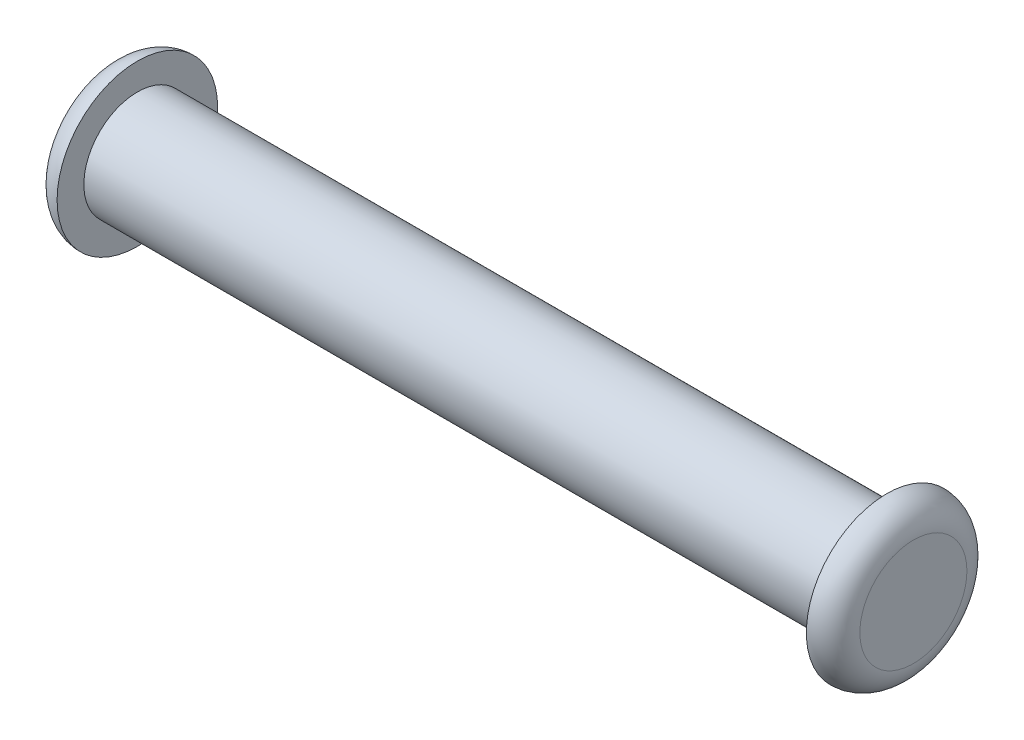
from build123d import *

# Parameters (mm, degrees)
SKETCH2_R            = 2
BOSS_EXTRUDE1_DEPTH  = 28
SKETCH3_R            = 3
BOSS_EXTRUDE2_DEPTH  = 1
FILLET1_R            = 1
FILLET1_OF_MIRROR1_R = 1


with BuildPart() as part:
    # Sketch2 → Boss-Extrude1 (new body)
    with BuildSketch(Plane(origin=(0, 0, 0), x_dir=(0, 0, -1), z_dir=(1, 0, 0))):
        Circle(SKETCH2_R)
    extrude(amount=BOSS_EXTRUDE1_DEPTH)

    # Sketch3 → Boss-Extrude2 (add)
    with BuildSketch(Plane(origin=(28, 0, 0), x_dir=(0, 0, -1), z_dir=(1, 0, 0))):
        Circle(SKETCH3_R)
    boss_extrude2 = extrude(amount=BOSS_EXTRUDE2_DEPTH)

    # Fillet1
    fillet1_edges = [part.edges().sort_by_distance(p)[0] for p in [
        (29, 0, 3),
    ]]
    fillet(fillet1_edges, radius=FILLET1_R - 0.0001)  # a hair under: the kernel refuses the full size

    # Mirror1: Boss-Extrude2 across plane
    add(boss_extrude2.mirror(Plane.ZY.offset(-14)))

    # Fillet1 of Mirror1
    fillet1_of_mirror1_edges = [part.edges().sort_by_distance(p)[0] for p in [
        (-1, 0, 3),
    ]]
    fillet(fillet1_of_mirror1_edges, radius=FILLET1_OF_MIRROR1_R - 0.0001)  # a hair under: the kernel refuses the full size


solid = part.part
